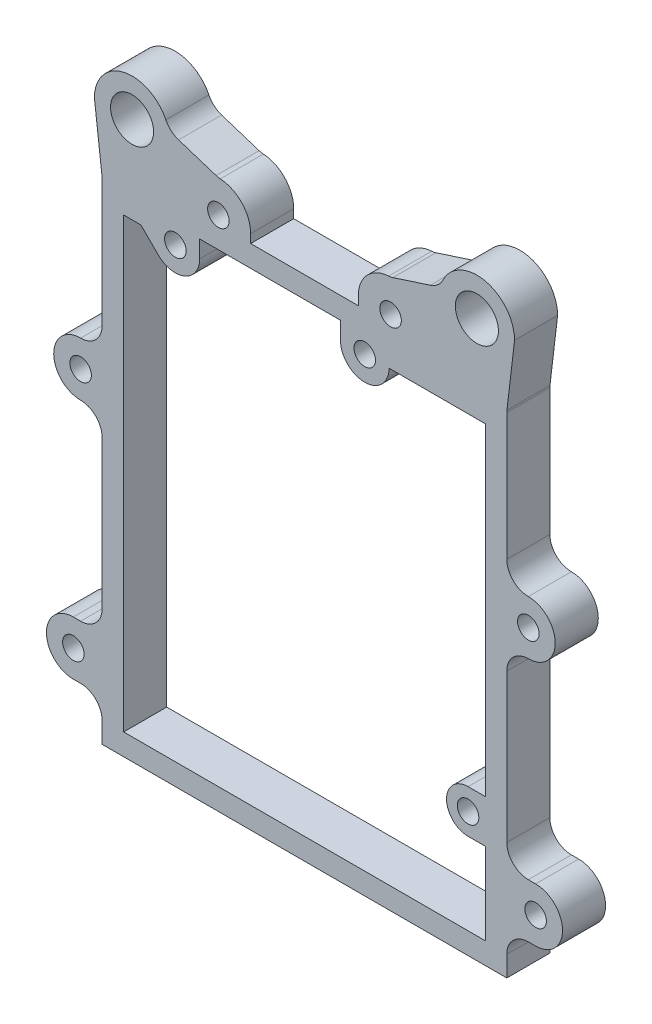
from build123d import *

# Parameters (mm, degrees)
SKETCH1_R           = 1.5875
BOSS_EXTRUDE1_DEPTH = 6.35
SKETCH3_R           = 1.5875
BOSS_EXTRUDE2_DEPTH = 6.35
FILLET1_R           = 3.175
BOSS_EXTRUDE3_START = -6.35
SKETCH4_R           = 3.175
SKETCH4_R_2         = 1.5875
BOSS_EXTRUDE3_DEPTH = 6.35
FILLET2_R           = 3.175
FILLET3_R           = 2.54


with BuildPart() as part:
    # Sketch1 → Boss-Extrude1 (new body)
    with BuildSketch(Plane.XY):
        with BuildLine():
            Line((13.97, -3.175), (39.37, -3.175))
            Line((39.37, -3.175), (56.515, -3.175))
            Line((56.515, -3.175), (56.515, 69.215))
            Line((56.515, 69.215), (41.625085175, 77.219758289))
            ThreePointArc((41.625085175, 77.219758289), (36.926481727, 77.112863097), (34.6075, 73.025))
            Line((34.6075, 73.025), (34.6075, 71.755))
            Line((34.6075, 71.755), (18.7325, 71.755))
            Line((18.7325, 71.755), (18.7325, 73.025))
            ThreePointArc((18.7325, 73.025), (16.413518273, 77.112863097), (11.714914825, 77.219758289))
            Line((11.714914825, 77.219758289), (-3.175, 69.215))
            Line((-3.175, 69.215), (-3.175, -3.175))
            Line((-3.175, -3.175), (13.97, -3.175))
        make_face()
        with Locations((35.56, 66.04)):
            Circle(SKETCH1_R, mode=Mode.SUBTRACT)
        with Locations((7.62, 66.04)):
            Circle(SKETCH1_R, mode=Mode.SUBTRACT)
        with Locations((50.8, 15.24)):
            Circle(SKETCH1_R, mode=Mode.SUBTRACT)
        with Locations((39.37, 73.025)):
            Circle(SKETCH1_R, mode=Mode.SUBTRACT)
        with Locations(Location((13.97, 73.025, 0), (0, 0, 180))):
            Circle(SKETCH1_R, mode=Mode.SUBTRACT)
        with BuildLine():
            Line((0, 11.093834149), (0, 16.5575))
            Line((0, 16.5575), (0, 66.04))
            Line((0, 66.04), (2.54, 66.04))
            Line((2.54, 66.04), (5.08, 63.506513025))
            ThreePointArc((5.08, 63.506513025), (8.990749111, 62.724701654), (11.2075, 66.04))
            Line((11.2075, 66.04), (11.2075, 68.58))
            Line((11.2075, 68.58), (31.9725, 68.58))
            Line((31.9725, 68.58), (31.9725, 66.04))
            ThreePointArc((31.9725, 66.04), (35.56, 62.4525), (39.1475, 66.04))
            Line((39.1475, 66.04), (40.386, 66.04))
            Line((40.386, 66.04), (53.34, 66.04))
            Line((53.34, 66.04), (53.34, 18.415))
            Line((53.34, 18.415), (50.8, 18.415))
            ThreePointArc((50.8, 18.415), (47.625, 15.24), (50.8, 12.065))
            Line((50.8, 12.065), (53.34, 12.065))
            Line((53.34, 12.065), (53.34, 0))
            Line((53.34, 0), (0, 0))
            Line((0, 0), (0, 11.093834149))
        make_face(mode=Mode.SUBTRACT)
    extrude(amount=BOSS_EXTRUDE1_DEPTH)

    # Sketch3 → Boss-Extrude2 (add)
    # profile 1 of 2: a face of its own
    with BuildSketch(Plane.XY.offset(6.35)):
        with BuildLine():
            Line((-7.423658, 10.969244), (-3.175, 10.969244))
            Line((-3.175, 10.969244), (-3.175, 3.031744))
            Line((-3.175, 3.031744), (-7.423658, 3.031744))
            ThreePointArc((-7.423658, 3.031744), (-11.392408, 7.000494), (-7.423658, 10.969244))
        make_face()
        with Locations((-7.423658, 7.000494)):
            Circle(SKETCH3_R, mode=Mode.SUBTRACT)
    # profile 2 of 2: a face of its own
    with BuildSketch(Plane.XY.offset(6.35)):
        with BuildLine():
            Line((56.515, 3.031744), (56.515, 10.969244))
            Line((56.515, 10.969244), (60.763658, 10.969244))
            ThreePointArc((60.763658, 10.969244), (64.732408, 7.000494), (60.763658, 3.031744))
            Line((60.763658, 3.031744), (56.515, 3.031744))
        make_face()
        with Locations((60.763658, 7.000494)):
            Circle(SKETCH3_R, mode=Mode.SUBTRACT)
    extrude(amount=-BOSS_EXTRUDE2_DEPTH)

    # Fillet1
    fillet1_edges = [part.edges().sort_by_distance(p)[0] for p in [
        (56.515, 3.031744, 3.175),
        (56.515, 10.969244, 3.175),
        (-3.175, 10.969244, 3.175),
        (-3.175, 3.031744, 3.175),
    ]]
    fillet(fillet1_edges, radius=FILLET1_R)

    # Sketch4 → Boss-Extrude3 (add)
    # profile 1 of 4: a face of its own
    with BuildSketch(Plane.XY.offset(6.35).offset(BOSS_EXTRUDE3_START)):
        with BuildLine():
            Line((-4.164100811, 77.557794463), (-3.175, 69.215))
            Line((-3.175, 69.215), (11.714914825, 77.219758289))
            ThreePointArc((11.714914825, 77.219758289), (12.807272625, 77.643384057), (13.97, 77.7875))
            Line((13.97, 77.7875), (6.640337345, 80.156211745))
            ThreePointArc((6.640337345, 80.156211745), (0.583964497, 84.374611001), (-4.318131733, 78.857003104))
            Line((-4.318131733, 78.857003104), (-4.164100811, 77.557794463))
        make_face()
        with Locations((1.238118267, 78.857003104)):
            Circle(SKETCH4_R, mode=Mode.SUBTRACT)
    # profile 2 of 4: a face of its own
    with BuildSketch(Plane.XY.offset(6.35).offset(BOSS_EXTRUDE3_START)):
        with BuildLine():
            Line((41.625085175, 77.219758289), (56.515, 69.215))
            Line((56.515, 69.215), (57.504100811, 77.557794463))
            Line((57.504100811, 77.557794463), (57.658131733, 78.857003104))
            ThreePointArc((57.658131733, 78.857003104), (52.756035503, 84.374611001), (46.699662655, 80.156211745))
            Line((46.699662655, 80.156211745), (39.37, 77.7875))
            ThreePointArc((39.37, 77.7875), (40.532727375, 77.643384057), (41.625085175, 77.219758289))
        make_face()
        with Locations((52.101881733, 78.857003104)):
            Circle(SKETCH4_R, mode=Mode.SUBTRACT)
    # profile 3 of 4: a face of its own
    with BuildSketch(Plane.XY.offset(6.35).offset(BOSS_EXTRUDE3_START)):
        with BuildLine():
            Line((56.515, 47.137146639), (56.515, 39.199646639))
            Line((56.515, 39.199646639), (59.69, 39.199646639))
            ThreePointArc((59.69, 39.199646639), (63.65875, 43.168396639), (59.69, 47.137146639))
            Line((59.69, 47.137146639), (56.515, 47.137146639))
        make_face()
        with Locations((59.69, 43.168396639)):
            Circle(SKETCH4_R_2, mode=Mode.SUBTRACT)
    # profile 4 of 4: a face of its own
    with BuildSketch(Plane.XY.offset(6.35).offset(BOSS_EXTRUDE3_START)):
        with BuildLine():
            Line((-3.175, 47.137146639), (-6.35, 47.137146639))
            ThreePointArc((-6.35, 47.137146639), (-10.31875, 43.168396639), (-6.35, 39.199646639))
            Line((-6.35, 39.199646639), (-3.175, 39.199646639))
            Line((-3.175, 39.199646639), (-3.175, 47.137146639))
        make_face()
        with Locations((-6.35, 43.168396639)):
            Circle(SKETCH4_R_2, mode=Mode.SUBTRACT)
    extrude(amount=BOSS_EXTRUDE3_DEPTH)

    # Fillet2
    fillet2_edges = [part.edges().sort_by_distance(p)[0] for p in [
        (46.699662655, 80.156211745, 3.175),
        (6.640337345, 80.156211745, 3.175),
        (-3.175, 47.137146639, 3.175),
        (56.515, 47.137146639, 3.175),
        (56.515, 39.199646639, 3.175),
        (-3.175, 39.199646639, 3.175),
    ]]
    fillet(fillet2_edges, radius=FILLET2_R - 0.0001)  # a hair under: the kernel refuses the full size

    # Fillet3
    fillet3_edges = [part.edges().sort_by_distance(p)[0] for p in [
        (-3.175, 69.215, 3.175),
        (13.97, 77.7875, 3.175),
        (56.515, 69.215, 3.175),
        (39.37, 77.7875, 3.175),
    ]]
    fillet(fillet3_edges, radius=FILLET3_R)


solid = part.part
